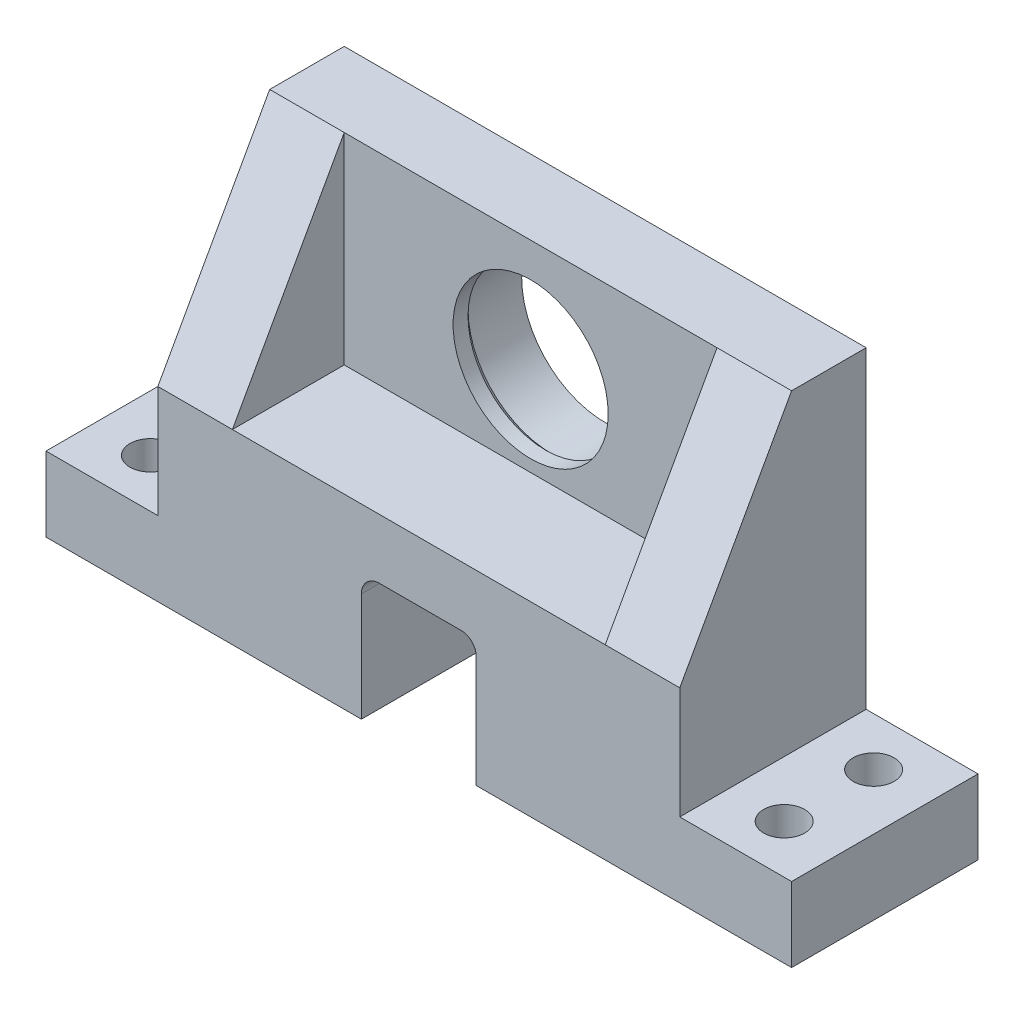
from build123d import *

# Parameters (mm, degrees)
BOSS_EXTRUDE1_DEPTH  = 25
SKETCH2_R            = 11.2
CUT_EXTRUDE1_DEPTH   = 77.347887987
SKETCH11_W           = 90
SKETCH11_H           = 30
CUT_EXTRUDE4_DEPTH   = 15
BOSS_EXTRUDE2_DEPTH  = 10
BOSS_EXTRUDE3_DEPTH  = 10
SKETCH14_R           = 11.4
SKETCH14_R_2         = 10.4
BOSS_EXTRUDE4_DEPTH  = 3
CHAMFER1_SIZE        = 1
M5_CLEARANCE_HOLE1_D = 5.5


with BuildPart() as part:
    # Sketch1 → Boss-Extrude1 (new body)
    with BuildSketch(Plane.XY):
        with BuildLine():
            Line((50, 0), (50, 10))
            Line((50, 10), (35, 10))
            Line((35, 10), (35, 52))
            Line((35, 52), (-35, 52))
            Line((-35, 52), (-35, 10))
            Line((-35, 10), (-50, 10))
            Line((-50, 10), (-50, 0))
            Line((-50, 0), (-7.7, 0))
            Line((-7.7, 0), (-7.7, 14.560093328))
            ThreePointArc((-7.7, 14.560093328), (-6.985367881, 16.285367881), (-5.260093328, 17))
            Line((-5.260093328, 17), (5.7, 17))
            ThreePointArc((5.7, 17), (7.114213562, 16.414213562), (7.7, 15))
            Line((7.7, 15), (7.7, 0))
            Line((7.7, 0), (50, 0))
        make_face()
    extrude(amount=BOSS_EXTRUDE1_DEPTH)

    # Sketch2 → Cut-Extrude1 (cut, through all)
    with BuildSketch(Plane(origin=(0, 0, 0), x_dir=(-1, 0, 0), z_dir=(0, 0, -1))):
        with Locations((0, 37)):
            Circle(SKETCH2_R)
    extrude(amount=-CUT_EXTRUDE1_DEPTH, mode=Mode.SUBTRACT)

    # Sketch11 → Cut-Extrude4 (cut)
    with BuildSketch(Plane.XY.offset(25)):
        with Locations((0, 40)):
            Rectangle(SKETCH11_W, SKETCH11_H)
    extrude(amount=-CUT_EXTRUDE4_DEPTH, mode=Mode.SUBTRACT)

    # Sketch12 → Boss-Extrude2 (add)
    with BuildSketch(Plane.ZY.offset(35)):
        Polygon((10, 52), (10, 25), (25, 25), align=None)
    extrude(amount=-BOSS_EXTRUDE2_DEPTH)

    # Sketch13 → Boss-Extrude3 (add)
    with BuildSketch(Plane(origin=(35, 0, 0), x_dir=(0, 0, -1), z_dir=(1, 0, 0))):
        Polygon((-10, 52), (-10, 25), (-25, 25), align=None)
    extrude(amount=-BOSS_EXTRUDE3_DEPTH)

    # Sketch14 → Boss-Extrude4 (add)
    with BuildSketch(Plane.XY.offset(10)):
        with Locations((0, 37)):
            Circle(SKETCH14_R)
        with Locations((0, 37)):
            Circle(SKETCH14_R_2, mode=Mode.SUBTRACT)
    extrude(amount=-BOSS_EXTRUDE4_DEPTH)

    # Chamfer1
    # the kernel refuses this chamfer: 1 mm, written as the material it takes off along each edge
    with BuildSketch(Plane(origin=(0, 37, 7), x_dir=(1, 0, 0), z_dir=(0, -1, 0))) as chamfer1_piece_1_section:
        Polygon((10.4 + CHAMFER1_SIZE, 0), (10.4, CHAMFER1_SIZE), (10.4, 0), align=None)
    chamfer1_piece_1 = revolve(axis=Axis((0, 37, 7), (0, 0, 1)), mode=Mode.PRIVATE)
    chamfer1_piece_1 = chamfer1_piece_1 & Plane(origin=(0, 37, 7.590998704), x_dir=(-1, 0, 0), z_dir=(0, 0, -1)) * Cylinder(11.2, 46, mode=Mode.PRIVATE)
    add(chamfer1_piece_1, mode=Mode.SUBTRACT)

    # M5 Clearance Hole1 (through all)
    with Locations(Plane(origin=(0, 10, 0), x_dir=(1, 0, 0), z_dir=(0, 1, 0))):
        with Locations((42.5, -18.5), (42.5, -6.5), (-42.5, -18.5), (-42.5, -6.5)):
            Hole(M5_CLEARANCE_HOLE1_D / 2)


solid = part.part
